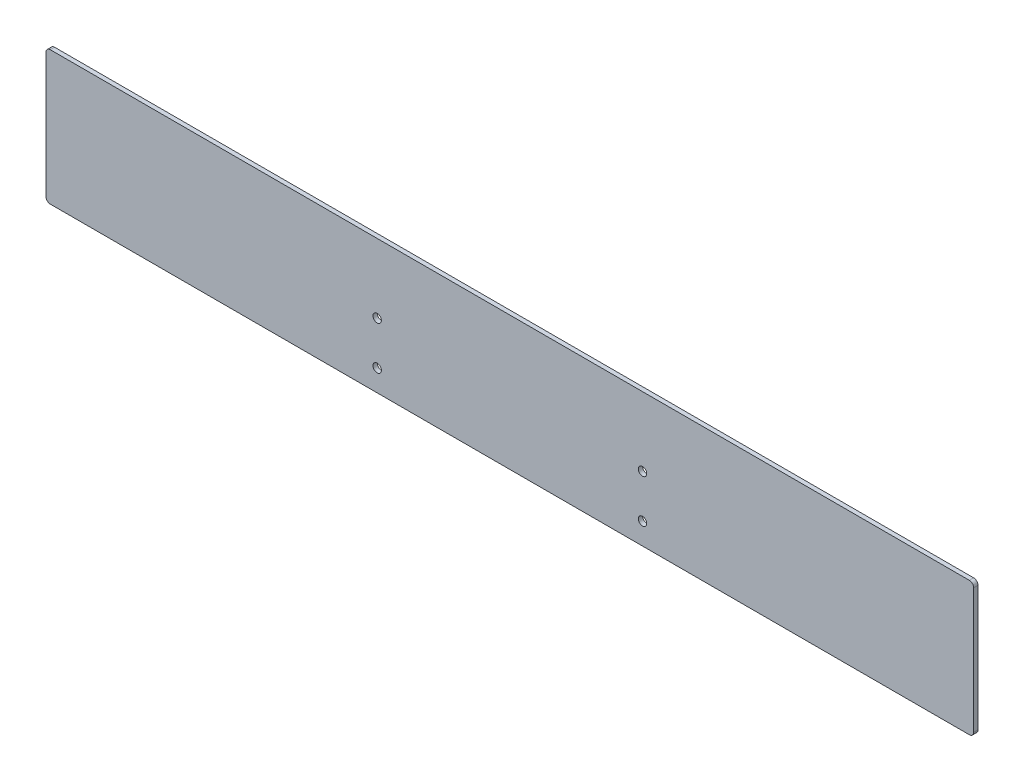
from build123d import *

# Parameters (mm, degrees)
SKETCH1_W           = 430
SKETCH1_H           = 62
SKETCH1_R           = 1.95
BOSS_EXTRUDE1_DEPTH = 2
FILLET1_R           = 2


with BuildPart() as part:
    # Sketch1 → Boss-Extrude1 (new body)
    with BuildSketch(Plane.XY):
        with Locations((-141.905896291, -13.296482412)):
            Rectangle(SKETCH1_W, SKETCH1_H)
        with Locations((-80.405896291, -14.296482412)):
            Circle(SKETCH1_R, mode=Mode.SUBTRACT)
        with Locations((-80.405896291, -34.296482412)):
            Circle(SKETCH1_R, mode=Mode.SUBTRACT)
        with Locations((-203.405896291, -14.296482412)):
            Circle(SKETCH1_R, mode=Mode.SUBTRACT)
        with Locations((-203.405896291, -34.296482412)):
            Circle(SKETCH1_R, mode=Mode.SUBTRACT)
    extrude(amount=BOSS_EXTRUDE1_DEPTH)

    # Fillet1
    fillet1_edges = [part.edges().sort_by_distance(p)[0] for p in [
        (73.094103709, 17.703517588, 1),
        (73.094103709, -44.296482412, 1),
        (-356.905896291, -44.296482412, 1),
        (-356.905896291, 17.703517588, 1),
    ]]
    fillet(fillet1_edges, radius=FILLET1_R)


solid = part.part
